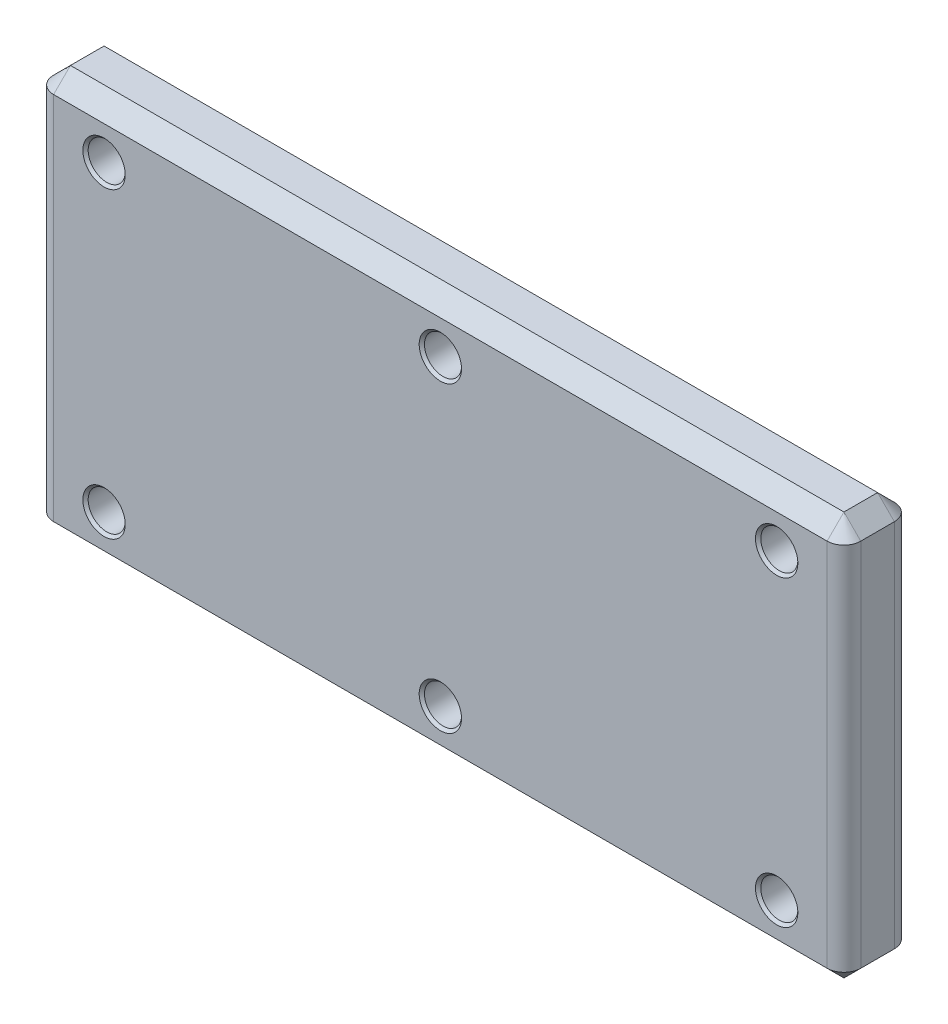
from build123d import *

# Parameters (mm, degrees)
SKETCH1_W                     = 76.2
SKETCH1_H                     = 38.1
BOSS_EXTRUDE1_DEPTH           = 3.175
SKETCH1_2_W                   = 76.2
SKETCH1_2_H                   = 38.1
BOSS_EXTRUDE2_DEPTH           = 3.175
SKETCH10_W                    = 76.2
SKETCH10_H                    = 6.35
CUT_EXTRUDE2_DEPTH            = 0.254
M3_CLEARANCE_HOLE1_AT_2_COUNT = 2
M3_CLEARANCE_HOLE1_AT_2_PITCH = 28.575
M3_CLEARANCE_HOLE1_AT_3_COUNT = 2
M3_CLEARANCE_HOLE1_AT_3_PITCH = 31.75
M3_CLEARANCE_HOLE1_AT_4_COUNT = 2
M3_CLEARANCE_HOLE1_AT_4_PITCH = 42.715256349
M3_CLEARANCE_HOLE1_AT_5_COUNT = 2
M3_CLEARANCE_HOLE1_AT_5_PITCH = 63.5
M3_CLEARANCE_HOLE1_AT_6_COUNT = 2
M3_CLEARANCE_HOLE1_AT_6_PITCH = 69.633186233
FILLET1_R                     = 1.5875
CHAMFER1_SIZE                 = 1.5875
CHAMFER3_SIZE                 = 0.254


with BuildPart() as part:
    # Sketch1 → Boss-Extrude1 (new, symmetric)
    with BuildSketch(Plane.XY):
        Rectangle(SKETCH1_W, SKETCH1_H)
    extrude(amount=BOSS_EXTRUDE1_DEPTH, both=True)

    # Sketch1<2> → Boss-Extrude2 (add, symmetric)
    with BuildSketch(Plane.XY):
        Rectangle(SKETCH1_2_W, SKETCH1_2_H)
    extrude(amount=BOSS_EXTRUDE2_DEPTH, both=True)

    # Sketch10 → Cut-Extrude2 (cut)
    with BuildSketch(Plane(origin=(0, 0, -3.175), x_dir=(-1, 0, 0), z_dir=(0, 0, -1))):
        with Locations((0, 6.35)):
            Rectangle(SKETCH10_W, SKETCH10_H)
        with Locations((0, -6.35)):
            Rectangle(SKETCH10_W, SKETCH10_H)
    extrude(amount=-CUT_EXTRUDE2_DEPTH, mode=Mode.SUBTRACT)

    # Sketch4 → M3 Clearance Hole1 (revolve, cut)
    with BuildSketch(Plane(origin=(-31.75, 14.2875, 3.175), x_dir=(0, -1, 0), z_dir=(1, 0, 0))):
        Polygon((0, 0), (0, 6.35), (2, 6.35), (1.75, 6.1), (1.75, 0.25), (2, 0), align=None)
    m3_clearance_hole1 = revolve(axis=Axis((-31.75, 14.2875, 9.525), (0, 0, -1)), mode=Mode.SUBTRACT)

    # M3 Clearance Hole1 at 2: M3 Clearance Hole1 ×2
    with Locations(*[(0, -i * M3_CLEARANCE_HOLE1_AT_2_PITCH, 0) for i in range(1, M3_CLEARANCE_HOLE1_AT_2_COUNT)]):
        add(m3_clearance_hole1, mode=Mode.SUBTRACT)

    # M3 Clearance Hole1 at 3: M3 Clearance Hole1 ×2
    with Locations(*[(i * M3_CLEARANCE_HOLE1_AT_3_PITCH, 0, 0) for i in range(1, M3_CLEARANCE_HOLE1_AT_3_COUNT)]):
        add(m3_clearance_hole1, mode=Mode.SUBTRACT)

    # M3 Clearance Hole1 at 4: M3 Clearance Hole1 ×2
    with Locations(*[Vector(0.7432941462471665, -0.6689647316224495, 0) * (i * M3_CLEARANCE_HOLE1_AT_4_PITCH) for i in range(1, M3_CLEARANCE_HOLE1_AT_4_COUNT)]):
        add(m3_clearance_hole1, mode=Mode.SUBTRACT)

    # M3 Clearance Hole1 at 5: M3 Clearance Hole1 ×2
    with Locations(*[(i * M3_CLEARANCE_HOLE1_AT_5_PITCH, 0, 0) for i in range(1, M3_CLEARANCE_HOLE1_AT_5_COUNT)]):
        add(m3_clearance_hole1, mode=Mode.SUBTRACT)

    # M3 Clearance Hole1 at 6: M3 Clearance Hole1 ×2
    with Locations(*[Vector(0.9119215051751064, -0.4103646773287979, 0) * (i * M3_CLEARANCE_HOLE1_AT_6_PITCH) for i in range(1, M3_CLEARANCE_HOLE1_AT_6_COUNT)]):
        add(m3_clearance_hole1, mode=Mode.SUBTRACT)

    # Fillet1
    fillet1_edges = [part.edges().sort_by_distance(p)[0] for p in [
        (-38.1, -14.2875, -3.175),
        (-38.1, 0, 3.175),
        (38.1, 0, 3.175),
        (38.1, -14.2875, -3.175),
    ]]
    fillet(fillet1_edges, radius=FILLET1_R)

    # Chamfer1
    chamfer1_edges = [part.edges().sort_by_distance(p)[0] for p in [
        (-38.1, -19.05, 0),
        (-38.1, 19.05, 0),
        (0, -19.05, -3.175),
        (38.1, -19.05, 0),
        (0, -19.05, 3.175),
        (37.635032015, -19.05, -2.710032015),
        (37.635032015, -19.05, 2.710032015),
        (-37.635032015, -19.05, 2.710032015),
        (-37.635032015, -19.05, -2.710032015),
        (-2.84e-07, 19.05, -3.175),
        (0, 19.05, 3.175),
        (38.1, 19.05, 0),
        (37.635032015, 19.05, -2.710032015),
        (37.635032015, 19.05, 2.710032015),
        (-37.635032015, 19.05, 2.710032015),
        (-37.635032216, 19.05, -2.710031814),
    ]]
    chamfer(chamfer1_edges, length=CHAMFER1_SIZE)

    # Chamfer3
    chamfer3_edges = [part.edges().sort_by_distance(p)[0] for p in [
        (0, -9.525, -3.175),
        (36.961512806, -9.525, -3.110176509),
        (-36.961512806, -9.525, -3.110176509),
        (2.84e-07, -3.175, -3.175),
        (36.961513079, -3.175, -3.110176428),
        (-36.961512806, -3.175, -3.110176509),
        (-2.84e-07, 3.175, -3.175),
        (36.961512806, 3.175, -3.110176509),
        (-36.961513079, 3.175, -3.110176428),
        (2.84e-07, 9.525, -3.175),
        (36.961513079, 9.525, -3.110176428),
        (-36.961512806, 9.525, -3.110176509),
    ]]
    chamfer(chamfer3_edges, length=CHAMFER3_SIZE - 0.0001)  # a hair under: the kernel refuses the full size


solid = part.part
